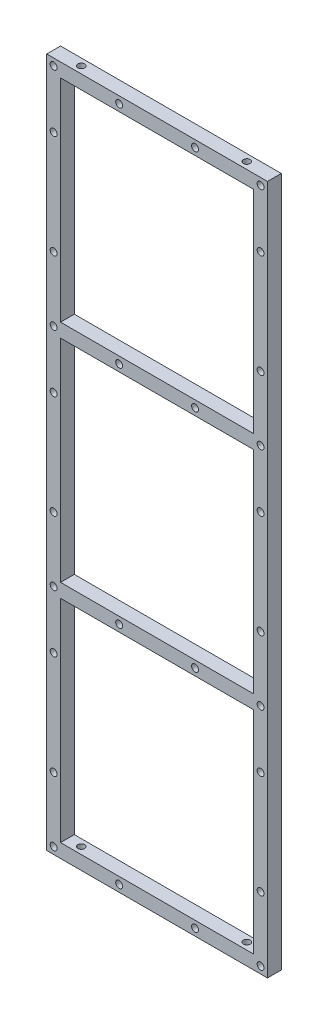
from build123d import *

# Parameters (mm, degrees)
SKETCH1_W           = 96
SKETCH1_H           = 300
SKETCH1_W_2         = 84
SKETCH1_H_2         = 92
BOSS_EXTRUDE1_DEPTH = 6
SKETCH2_R           = 1.5
CUT_EXTRUDE1_DEPTH  = 6
SKETCH3_R           = 1.5
CUT_EXTRUDE2_DEPTH  = 10
SKETCH4_R           = 1.5
CUT_EXTRUDE5_DEPTH  = 10


with BuildPart() as part:
    # Sketch1 → Boss-Extrude1 (new body)
    with BuildSketch(Plane.XY):
        Rectangle(SKETCH1_W, SKETCH1_H)
        with Locations((0, 98)):
            Rectangle(SKETCH1_W_2, SKETCH1_H_2, mode=Mode.SUBTRACT)
        with Locations((0, -98)):
            Rectangle(SKETCH1_W_2, SKETCH1_H_2, mode=Mode.SUBTRACT)
        Rectangle(SKETCH1_W_2, SKETCH1_H_2, mode=Mode.SUBTRACT)
    extrude(amount=BOSS_EXTRUDE1_DEPTH)

    # Sketch2 → Cut-Extrude1 (cut)
    with BuildSketch(Plane.XY.offset(6)):
        with Locations((-45, 147)):
            Circle(SKETCH2_R)
        with Locations((45, 147)):
            Circle(SKETCH2_R)
        with Locations((45, 49)):
            Circle(SKETCH2_R)
        with Locations((45, -49)):
            Circle(SKETCH2_R)
        with Locations((45, -147)):
            Circle(SKETCH2_R)
        with Locations((-45, 49)):
            Circle(SKETCH2_R)
        with Locations((-45, -49)):
            Circle(SKETCH2_R)
        with Locations((-45, -147)):
            Circle(SKETCH2_R)
    extrude(amount=-CUT_EXTRUDE1_DEPTH, mode=Mode.SUBTRACT)

    # Sketch3 → Cut-Extrude2 (cut)
    with BuildSketch(Plane.XY.offset(6)):
        with Locations((-45.000000834, 122)):
            Circle(SKETCH3_R)
        with Locations((-45.00000032, 77)):
            Circle(SKETCH3_R)
        with Locations((44.999999166, 122)):
            Circle(SKETCH3_R)
        with Locations((44.99999968, 77)):
            Circle(SKETCH3_R)
        with Locations((44.999999166, 24)):
            Circle(SKETCH3_R)
        with Locations((44.99999968, -21)):
            Circle(SKETCH3_R)
        with Locations((44.999999166, -74)):
            Circle(SKETCH3_R)
        with Locations((44.99999968, -119)):
            Circle(SKETCH3_R)
        with Locations((-45.000000834, 24)):
            Circle(SKETCH3_R)
        with Locations((-45.00000032, -21)):
            Circle(SKETCH3_R)
        with Locations((-45.000000834, -74)):
            Circle(SKETCH3_R)
        with Locations((-45.00000032, -119)):
            Circle(SKETCH3_R)
        with Locations((-16.5, 147)):
            Circle(SKETCH3_R)
        with Locations((-16.5, 49)):
            Circle(SKETCH3_R)
        with Locations((-16.5, -49)):
            Circle(SKETCH3_R)
        with Locations((-16.5, -147)):
            Circle(SKETCH3_R)
        with Locations((16.5, -147)):
            Circle(SKETCH3_R)
        with Locations((16.5, -49)):
            Circle(SKETCH3_R)
        with Locations((16.5, 49)):
            Circle(SKETCH3_R)
        with Locations((16.5, 147)):
            Circle(SKETCH3_R)
        with Locations((-45, -49)):
            Circle(SKETCH3_R)
    extrude(amount=-CUT_EXTRUDE2_DEPTH, mode=Mode.SUBTRACT)

    # Sketch4 → Cut-Extrude5 (cut)
    with BuildSketch(Plane(origin=(0, 150, 0), x_dir=(1, 0, 0), z_dir=(0, 1, 0))):
        with Locations((-36, -3)):
            Circle(SKETCH4_R)
        with Locations((36, -3)):
            Circle(SKETCH4_R)
    cut_extrude5 = extrude(amount=-CUT_EXTRUDE5_DEPTH, mode=Mode.SUBTRACT)

    # Mirror1: Cut-Extrude5 across plane
    add(cut_extrude5.mirror(Plane.ZX), mode=Mode.SUBTRACT)


solid = part.part
